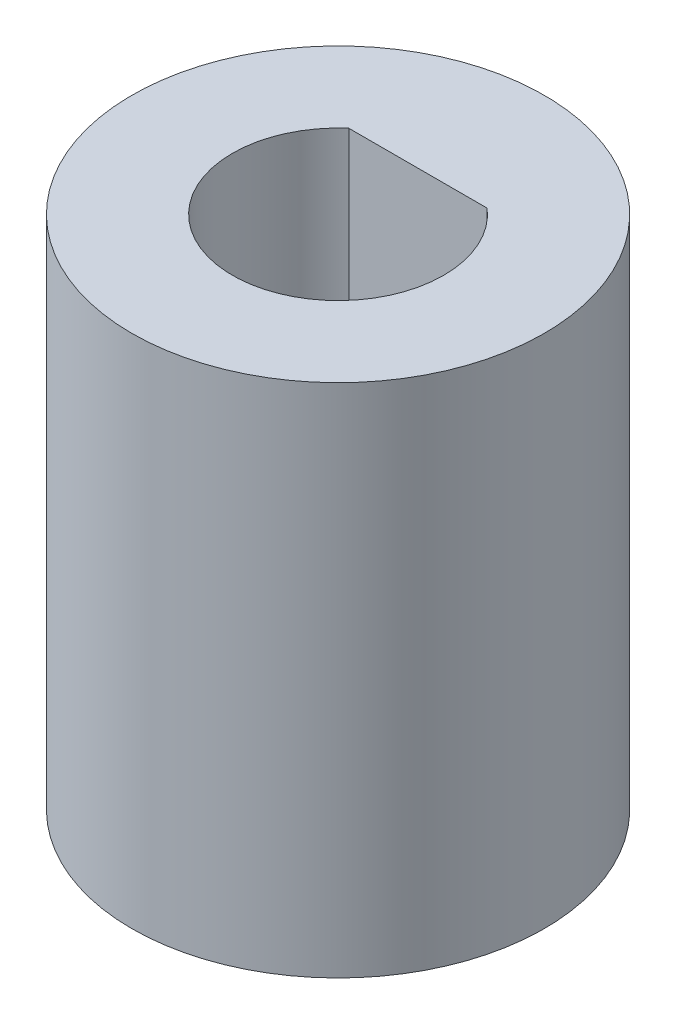
from build123d import *

# Parameters (mm, degrees)
SKETCH1_R           = 4
BOSS_EXTRUDE1_DEPTH = 10


with BuildPart() as part:
    # Sketch1 → Boss-Extrude1 (new body)
    with BuildSketch(Plane(origin=(0, 0, 0), x_dir=(1, 0, 0), z_dir=(0, 1, 0))):
        Circle(SKETCH1_R)
        with BuildLine():
            Line((-1.341640786, 1.55), (1.341640786, 1.55))
            ThreePointArc((1.341640786, 1.55), (0, -2.05), (-1.341640786, 1.55))
        make_face(mode=Mode.SUBTRACT)
    extrude(amount=BOSS_EXTRUDE1_DEPTH)


solid = part.part
